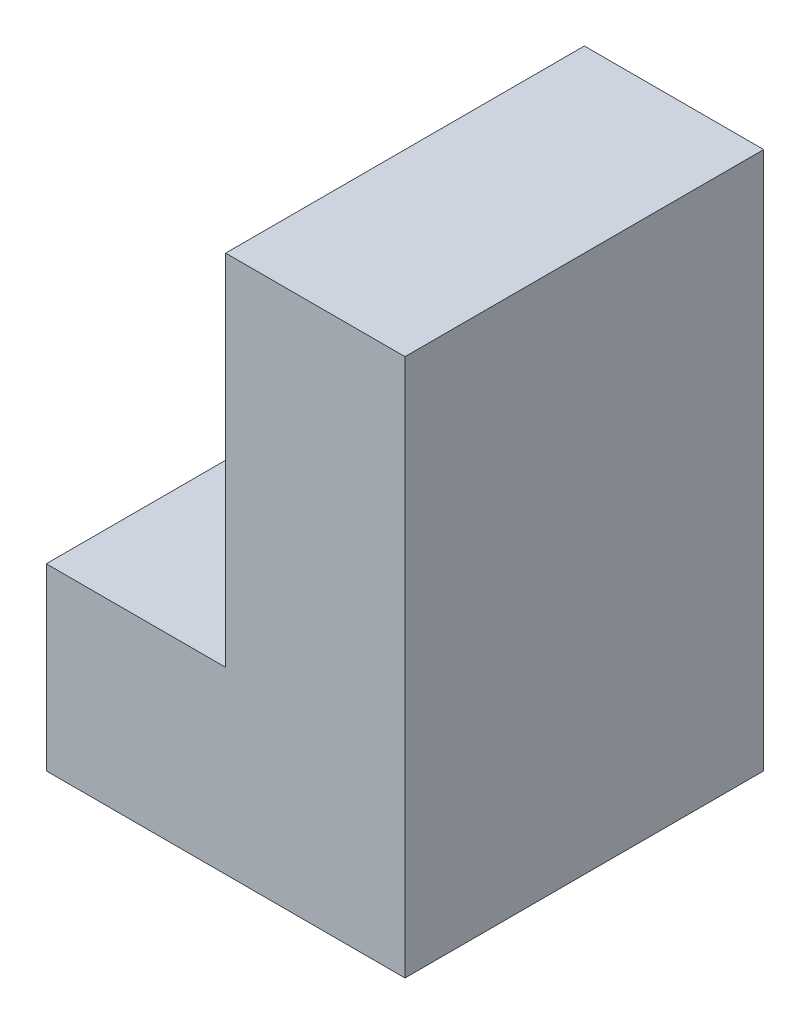
from build123d import *

# Parameters (mm, degrees)
RESSALTO_EXTRUS_O1_DEPTH = 20


with BuildPart() as part:
    # Esboço1 → Ressalto-extrusão1 (new body)
    with BuildSketch(Plane.XY):
        Polygon((0, 0), (0, -10), (20, -10), (20, 20), (10, 20), (10, 0), align=None)
    extrude(amount=-RESSALTO_EXTRUS_O1_DEPTH)


solid = part.part
